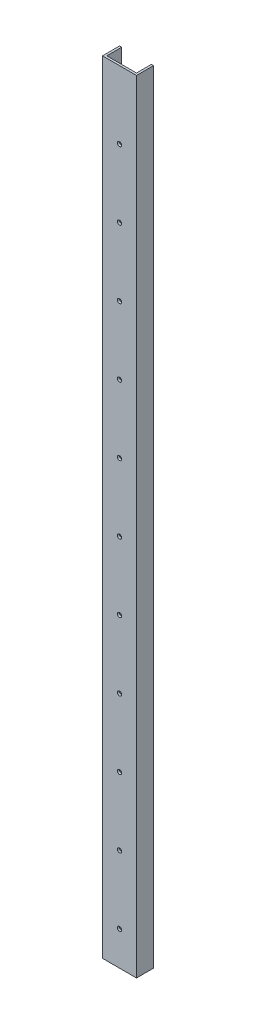
from build123d import *

# Parameters (mm, degrees)
BOSS_EXTRUDE1_DEPTH = 1168.4
CUT_EXTRUDE1_REACH  = 1171.78
SKETCH2_R           = 3.175


with BuildPart() as part:
    # Sketch1 → Boss-Extrude1 (new body)
    with BuildSketch(Plane(origin=(0, 0, 0), x_dir=(1, 0, 0), z_dir=(0, 1, 0))):
        Polygon((3.175, 3.175), (3.175, 25.4), (0, 25.4), (0, 0), (50.8, 0), (50.8, 25.4), (47.625, 25.4), (47.625, 3.175), align=None)
    extrude(amount=BOSS_EXTRUDE1_DEPTH)

    # Sketch2 → Cut-Extrude1 (cut, up to next)
    with BuildSketch(Plane.XY, mode=Mode.PRIVATE) as cut_extrude1_sk1:
        with Locations((25.4, 50.8)):
            Circle(SKETCH2_R)
    cut_extrude1_tool1 = extrude(cut_extrude1_sk1.sketch, amount=-CUT_EXTRUDE1_REACH, mode=Mode.PRIVATE) & part.part
    # Sketch2 → Cut-Extrude1 (cut, up to next)
    with BuildSketch(Plane.XY, mode=Mode.PRIVATE) as cut_extrude1_sk2:
        with Locations((25.4, 152.4)):
            Circle(SKETCH2_R)
    cut_extrude1_tool2 = extrude(cut_extrude1_sk2.sketch, amount=-CUT_EXTRUDE1_REACH, mode=Mode.PRIVATE) & part.part
    # Sketch2 → Cut-Extrude1 (cut, up to next)
    with BuildSketch(Plane.XY, mode=Mode.PRIVATE) as cut_extrude1_sk3:
        with Locations((25.4, 254)):
            Circle(SKETCH2_R)
    cut_extrude1_tool3 = extrude(cut_extrude1_sk3.sketch, amount=-CUT_EXTRUDE1_REACH, mode=Mode.PRIVATE) & part.part
    # Sketch2 → Cut-Extrude1 (cut, up to next)
    with BuildSketch(Plane.XY, mode=Mode.PRIVATE) as cut_extrude1_sk4:
        with Locations((25.4, 355.6)):
            Circle(SKETCH2_R)
    cut_extrude1_tool4 = extrude(cut_extrude1_sk4.sketch, amount=-CUT_EXTRUDE1_REACH, mode=Mode.PRIVATE) & part.part
    # Sketch2 → Cut-Extrude1 (cut, up to next)
    with BuildSketch(Plane.XY, mode=Mode.PRIVATE) as cut_extrude1_sk5:
        with Locations((25.4, 457.2)):
            Circle(SKETCH2_R)
    cut_extrude1_tool5 = extrude(cut_extrude1_sk5.sketch, amount=-CUT_EXTRUDE1_REACH, mode=Mode.PRIVATE) & part.part
    # Sketch2 → Cut-Extrude1 (cut, up to next)
    with BuildSketch(Plane.XY, mode=Mode.PRIVATE) as cut_extrude1_sk6:
        with Locations((25.4, 558.8)):
            Circle(SKETCH2_R)
    cut_extrude1_tool6 = extrude(cut_extrude1_sk6.sketch, amount=-CUT_EXTRUDE1_REACH, mode=Mode.PRIVATE) & part.part
    # Sketch2 → Cut-Extrude1 (cut, up to next)
    with BuildSketch(Plane.XY, mode=Mode.PRIVATE) as cut_extrude1_sk7:
        with Locations((25.4, 660.4)):
            Circle(SKETCH2_R)
    cut_extrude1_tool7 = extrude(cut_extrude1_sk7.sketch, amount=-CUT_EXTRUDE1_REACH, mode=Mode.PRIVATE) & part.part
    # Sketch2 → Cut-Extrude1 (cut, up to next)
    with BuildSketch(Plane.XY, mode=Mode.PRIVATE) as cut_extrude1_sk8:
        with Locations((25.4, 762)):
            Circle(SKETCH2_R)
    cut_extrude1_tool8 = extrude(cut_extrude1_sk8.sketch, amount=-CUT_EXTRUDE1_REACH, mode=Mode.PRIVATE) & part.part
    # Sketch2 → Cut-Extrude1 (cut, up to next)
    with BuildSketch(Plane.XY, mode=Mode.PRIVATE) as cut_extrude1_sk9:
        with Locations((25.4, 863.6)):
            Circle(SKETCH2_R)
    cut_extrude1_tool9 = extrude(cut_extrude1_sk9.sketch, amount=-CUT_EXTRUDE1_REACH, mode=Mode.PRIVATE) & part.part
    # Sketch2 → Cut-Extrude1 (cut, up to next)
    with BuildSketch(Plane.XY, mode=Mode.PRIVATE) as cut_extrude1_sk10:
        with Locations((25.4, 965.2)):
            Circle(SKETCH2_R)
    cut_extrude1_tool10 = extrude(cut_extrude1_sk10.sketch, amount=-CUT_EXTRUDE1_REACH, mode=Mode.PRIVATE) & part.part
    # Sketch2 → Cut-Extrude1 (cut, up to next)
    with BuildSketch(Plane.XY, mode=Mode.PRIVATE) as cut_extrude1_sk11:
        with Locations((25.4, 1066.8)):
            Circle(SKETCH2_R)
    cut_extrude1_tool11 = extrude(cut_extrude1_sk11.sketch, amount=-CUT_EXTRUDE1_REACH, mode=Mode.PRIVATE) & part.part
    add(cut_extrude1_tool1.solids().sort_by_distance((25.4, 50.8, 0))[0], mode=Mode.SUBTRACT)
    add(cut_extrude1_tool2.solids().sort_by_distance((25.4, 152.4, 0))[0], mode=Mode.SUBTRACT)
    add(cut_extrude1_tool3.solids().sort_by_distance((25.4, 254, 0))[0], mode=Mode.SUBTRACT)
    add(cut_extrude1_tool4.solids().sort_by_distance((25.4, 355.6, 0))[0], mode=Mode.SUBTRACT)
    add(cut_extrude1_tool5.solids().sort_by_distance((25.4, 457.2, 0))[0], mode=Mode.SUBTRACT)
    add(cut_extrude1_tool6.solids().sort_by_distance((25.4, 558.8, 0))[0], mode=Mode.SUBTRACT)
    add(cut_extrude1_tool7.solids().sort_by_distance((25.4, 660.4, 0))[0], mode=Mode.SUBTRACT)
    add(cut_extrude1_tool8.solids().sort_by_distance((25.4, 762, 0))[0], mode=Mode.SUBTRACT)
    add(cut_extrude1_tool9.solids().sort_by_distance((25.4, 863.6, 0))[0], mode=Mode.SUBTRACT)
    add(cut_extrude1_tool10.solids().sort_by_distance((25.4, 965.2, 0))[0], mode=Mode.SUBTRACT)
    add(cut_extrude1_tool11.solids().sort_by_distance((25.4, 1066.8, 0))[0], mode=Mode.SUBTRACT)


solid = part.part
